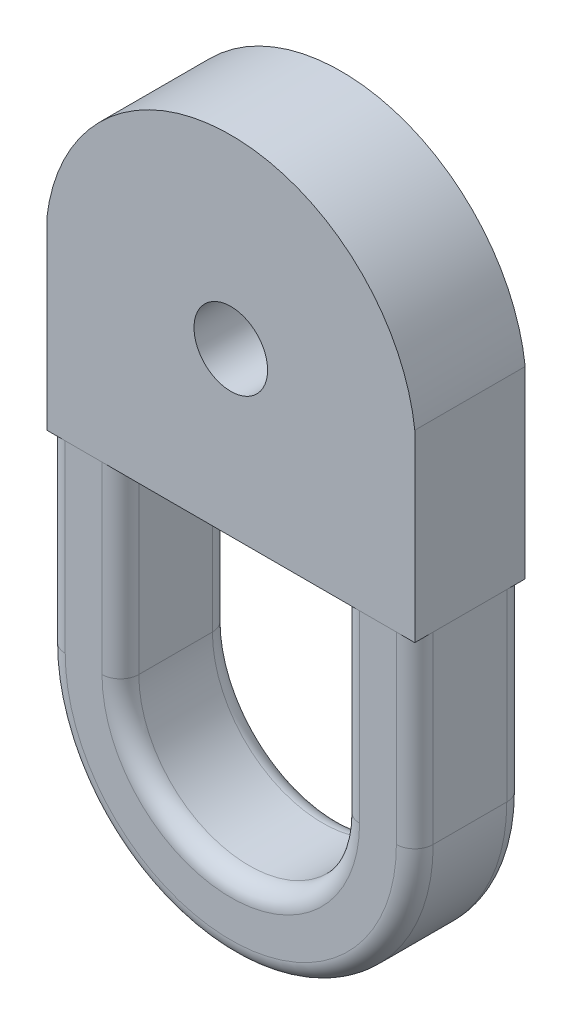
from build123d import *

# Parameters (mm, degrees)
SKETCH1_R           = 1
BOSS_EXTRUDE1_DEPTH = 3
BOSS_EXTRUDE2_DEPTH = 3
FILLET7_R           = 0.5


with BuildPart() as part:
    # Sketch1 → Boss-Extrude1 (new body)
    with BuildSketch(Plane.XY):
        with BuildLine():
            Line((0, 0), (0, 5))
            ThreePointArc((0, 5), (5, 9.447928245), (10, 5))
            Line((10, 5), (10, 0))
            Line((10, 0), (0, 0))
        make_face()
        with Locations((5, 4.413666988)):
            Circle(SKETCH1_R, mode=Mode.SUBTRACT)
    extrude(amount=BOSS_EXTRUDE1_DEPTH)


with BuildPart() as body_2:
    # Sketch2 → Boss-Extrude2 (new body)
    with BuildSketch(Plane.XY.offset(3)):
        with BuildLine():
            Line((2, 0), (0, 0))
            Line((0, 0), (0, -5))
            ThreePointArc((0, -5), (5, -10), (10, -5))
            Line((10, -5), (10, 0))
            Line((10, 0), (8, 0))
            Line((8, 0), (8, -5))
            ThreePointArc((8, -5), (5, -8), (2, -5))
            Line((2, -5), (2, 0))
        make_face()
    extrude(amount=-BOSS_EXTRUDE2_DEPTH)

    # Fillet7
    fillet7_edges = [body_2.edges().sort_by_distance(p)[0] for p in [
        (8, -2.5, 0),
        (5, -8, 0),
        (8, -2.5, 3),
        (5, -8, 3),
        (0, -2.5, 0),
        (10, -2.5, 0),
        (10, -2.5, 3),
        (5, -10, 3),
        (2, -2.5, 0),
        (2, -2.5, 3),
        (5, -10, 0),
        (0, -2.5, 3),
    ]]
    fillet(fillet7_edges, radius=FILLET7_R)


solid = Compound([part.part, body_2.part])
